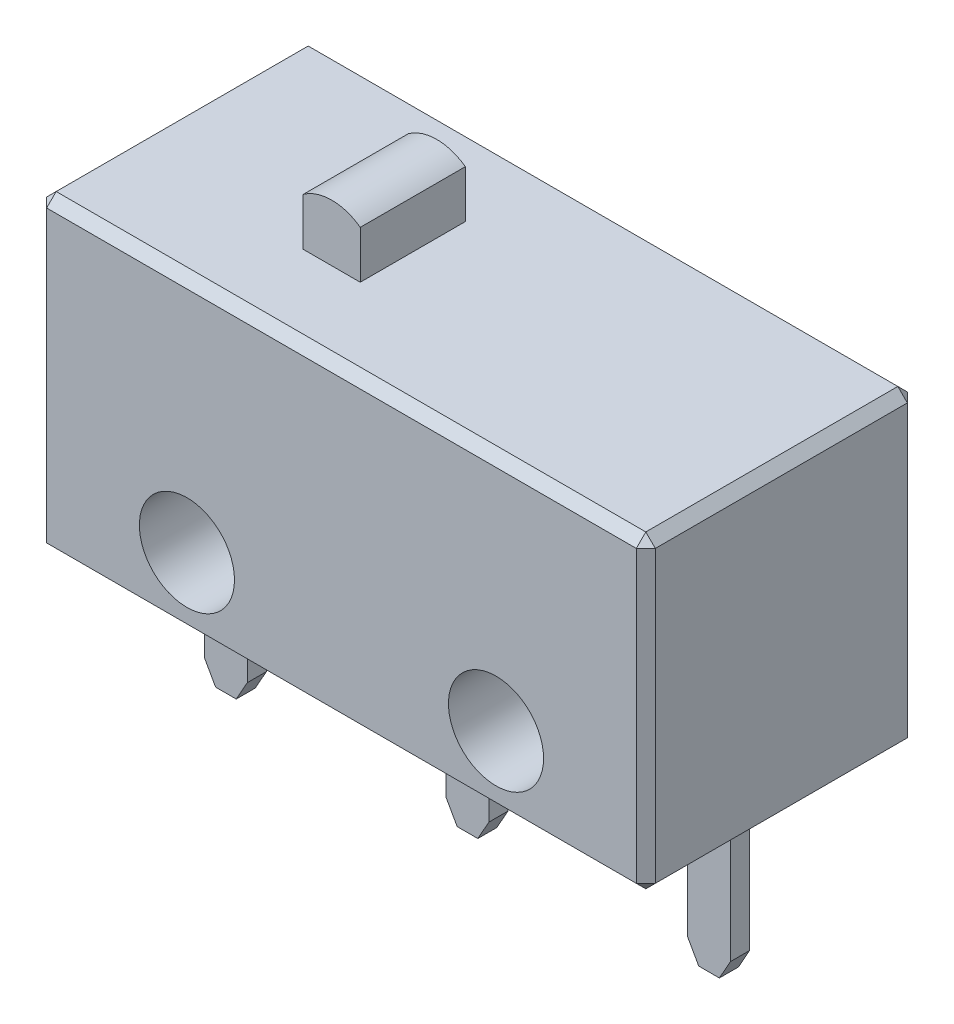
from build123d import *

# Parameters (mm, degrees)
SKETCH2_W           = 12.8
SKETCH2_H           = 6.5
SKETCH2_R           = 1
EXTRUDE1_DEPTH      = 2.85
EXTRUDE2_DEPTH      = 1.1049
BOSS_EXTRUDE2_DEPTH = 0.2
CHAMFER1_SIZE       = 0.2


with BuildPart() as part:
    # Sketch2 → Extrude1 (new, symmetric)
    with BuildSketch(Plane.XY):
        with Locations((0, 3.25)):
            Rectangle(SKETCH2_W, SKETCH2_H)
        with Locations((3.25, 1.5)):
            Circle(SKETCH2_R, mode=Mode.SUBTRACT)
        with Locations((-3.25, 1.5)):
            Circle(SKETCH2_R, mode=Mode.SUBTRACT)
    extrude(amount=EXTRUDE1_DEPTH, both=True)

    # Sketch12 → Boss-Extrude2 (add, symmetric)
    with BuildSketch(Plane.XY):
        Polygon((-0.45, 0), (-0.45, -2.884856908), (-0.217069054, -3.3), (0.217069054, -3.3), (0.45, -2.884856908), (0.45, 0), align=None)
        Polygon((-5.53, -2.884856908), (-5.297069054, -3.3), (-4.862930946, -3.3), (-4.63, -2.884856908), (-4.63, 0), (-5.53, 0), align=None)
        Polygon((4.63, -2.884856908), (4.862930946, -3.3), (5.297069054, -3.3), (5.53, -2.884856908), (5.53, 0), (4.63, 0), align=None)
    extrude(amount=BOSS_EXTRUDE2_DEPTH, both=True)

    # Chamfer1
    chamfer1_edges = [part.edges().sort_by_distance(p)[0] for p in [
        (0, 6.5, -2.85),
        (-6.4, 3.25, -2.85),
        (0, 0, -2.85),
        (6.4, 3.25, -2.85),
        (0, 0, 2.85),
        (-6.4, 3.25, 2.85),
        (0, 6.5, 2.85),
        (6.4, 3.25, 2.85),
        (6.4, 0, 0),
        (6.4, 6.5, 0),
        (-6.4, 6.5, 0),
        (-6.4, 0, 0),
    ]]
    chamfer(chamfer1_edges, length=CHAMFER1_SIZE)


with BuildPart() as body_2:
    # Sketch3 → Extrude2 (new, symmetric)
    with BuildSketch(Plane.XY):
        with BuildLine():
            Line((-2.55, 6.5), (-2.55, 7.5))
            ThreePointArc((-2.55, 7.5), (-1.95, 7.69608781), (-1.35, 7.5))
            Line((-1.35, 7.5), (-1.35, 6.5))
            Line((-1.35, 6.5), (-2.55, 6.5))
        make_face()
    extrude(amount=EXTRUDE2_DEPTH, both=True)


solid = Compound([part.part, body_2.part])
